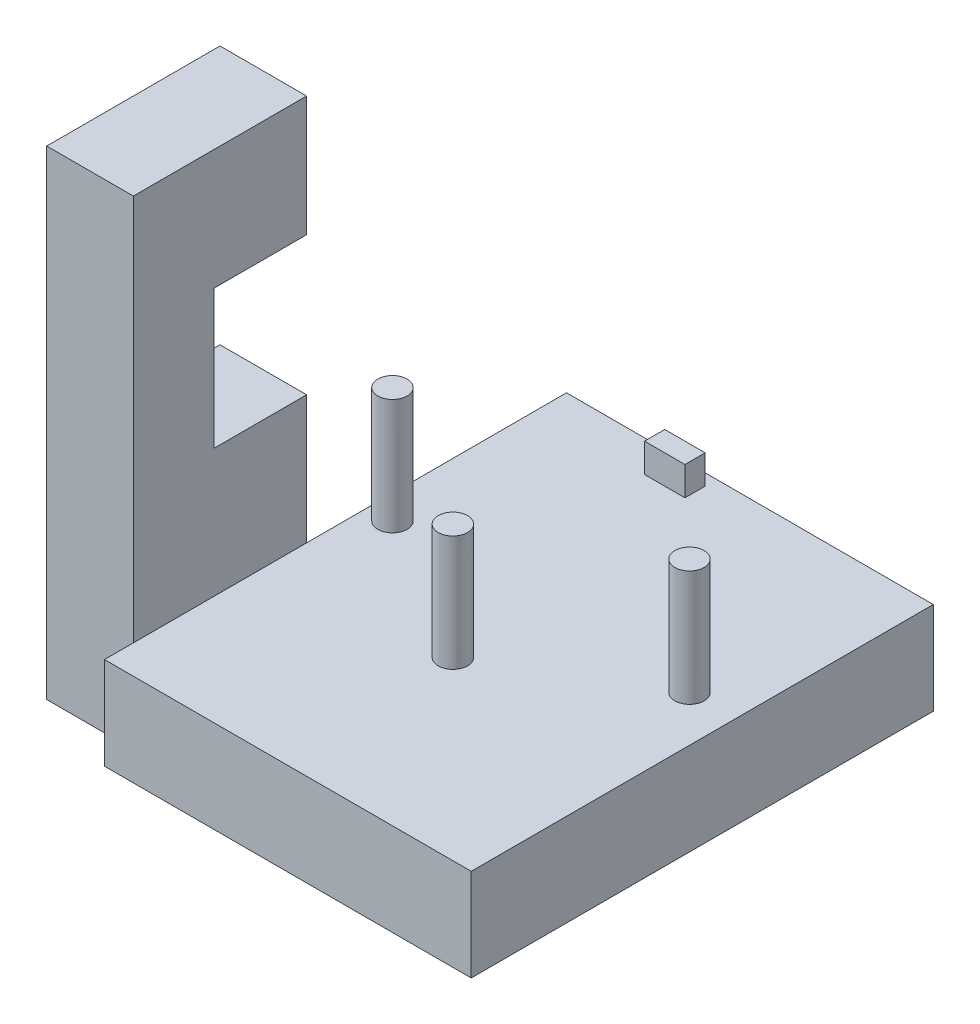
from build123d import *

# Parameters (mm, degrees)
SKETCH5_W            = 63.5
SKETCH5_H            = 80
BOSS_EXTRUDE4_DEPTH  = 16
SKETCH6_W            = 7
SKETCH6_H            = 3.5
BOSS_EXTRUDE5_DEPTH  = 5
SKETCH13_R           = 2.54
BOSS_EXTRUDE8_DEPTH  = 20
SKETCH9_W            = 15
SKETCH9_H            = 30
BOSS_EXTRUDE10_DEPTH = 83
SKETCH14_W           = 15
SKETCH14_H           = 24
CUT_EXTRUDE1_DEPTH   = 16


with BuildPart() as part:
    # Sketch5 → Boss-Extrude4 (new body)
    with BuildSketch(Plane(origin=(0, 0, 0), x_dir=(1, 0, 0), z_dir=(0, 1, 0))):
        Rectangle(SKETCH5_W, SKETCH5_H)
    extrude(amount=BOSS_EXTRUDE4_DEPTH)

    # Sketch6 → Boss-Extrude5 (add)
    with BuildSketch(Plane(origin=(0, 16, 0), x_dir=(1, 0, 0), z_dir=(0, 1, 0))):
        with Locations((-9.25, 36.25)):
            Rectangle(SKETCH6_W, SKETCH6_H)
    extrude(amount=BOSS_EXTRUDE5_DEPTH)

    # Sketch13 → Boss-Extrude8 (add)
    with BuildSketch(Plane(origin=(0, 16, 0), x_dir=(1, 0, 0), z_dir=(0, 1, 0))):
        with Locations((-27.6098, 5.72)):
            Circle(SKETCH13_R)
        with Locations((23.8252, 5.72)):
            Circle(SKETCH13_R)
        with Locations((-1.905, -9.52)):
            Circle(SKETCH13_R)
    extrude(amount=BOSS_EXTRUDE8_DEPTH)

    # Sketch9 → Boss-Extrude10 (add)
    with BuildSketch(Plane(origin=(0, 0, 0), x_dir=(1, 0, 0), z_dir=(0, 1, 0))):
        with Locations((-39.25, -20)):
            Rectangle(SKETCH9_W, SKETCH9_H)
    extrude(amount=BOSS_EXTRUDE10_DEPTH)

    # Sketch14 → Cut-Extrude1 (cut)
    with BuildSketch(Plane(origin=(0, 0, 5), x_dir=(-1, 0, 0), z_dir=(0, 0, -1))):
        with Locations((39.25, 50.2)):
            Rectangle(SKETCH14_W, SKETCH14_H)
    extrude(amount=-CUT_EXTRUDE1_DEPTH, mode=Mode.SUBTRACT)


solid = part.part
